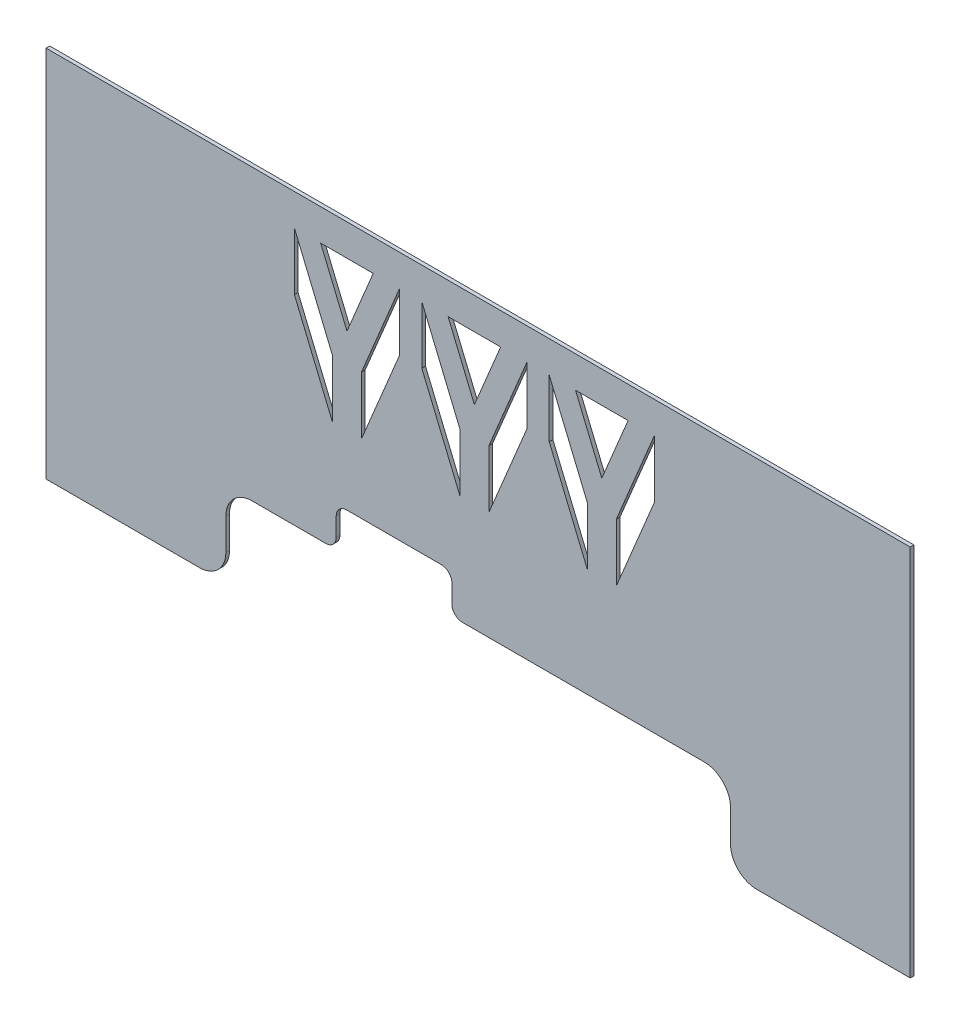
from build123d import *

# Parameters (mm, degrees)
BOSS_EXTRUDE1_DEPTH = 0.7
BOSS_EXTRUDE2_DEPTH = 5
FILLET1_R           = 5
FILLET2_R           = 2


with BuildPart() as part:
    # Sketch1 → Boss-Extrude1 (new body)
    with BuildSketch(Plane.XY):
        Polygon((0, 71), (0, 0), (34.19199, 0), (34.19199, 16), (55.19199, 16), (55.19199, 23.5), (77.19199, 23.5), (77.19199, 16), (130.19199, 16), (130.19199, 0), (164.38398, 0), (164.38398, 71), align=None)
        Polygon((47.233378, 65), (54.483378, 47.6), (54.483378, 36.6), (47.233378, 54), align=None, mode=Mode.SUBTRACT)
        Polygon((67.233378, 65), (67.233378, 54), (59.983378, 36.6), (59.983378, 47.6), align=None, mode=Mode.SUBTRACT)
        Polygon((71.472387, 65), (78.722387, 47.6), (78.722387, 36.6), (71.472387, 54), align=None, mode=Mode.SUBTRACT)
        Polygon((57.233378, 53), (52.233378, 65), (62.233378, 65), align=None, mode=Mode.SUBTRACT)
        Polygon((81.472387, 53), (76.472387, 65), (86.472387, 65), align=None, mode=Mode.SUBTRACT)
        Polygon((91.472387, 65), (91.472387, 54), (84.222387, 36.6), (84.222387, 47.6), align=None, mode=Mode.SUBTRACT)
        Polygon((95.711396, 65), (102.961396, 47.6), (102.961396, 36.6), (95.711396, 54), align=None, mode=Mode.SUBTRACT)
        Polygon((115.711396, 65), (115.711396, 54), (108.461396, 36.6), (108.461396, 47.6), align=None, mode=Mode.SUBTRACT)
        Polygon((105.711396, 53), (100.711396, 65), (110.711396, 65), align=None, mode=Mode.SUBTRACT)
    extrude(amount=BOSS_EXTRUDE1_DEPTH)

    # Sketch1<4> → Boss-Extrude2 (add)
    with BuildSketch(Plane.XY):
        Polygon((10.891348, 64.75), (15.516348, 53.65), (20.141348, 64.75), align=None)
        Polygon((5.766348, 63.75), (5.766348, 54.05), (12.516348, 37.85), (12.516348, 47.55), align=None)
        Polygon((25.266348, 63.75), (18.516348, 47.55), (18.516348, 37.85), (25.266348, 54.05), align=None)
        Polygon((144.673863, 64.75), (149.298863, 53.65), (153.923863, 64.75), align=None)
        Polygon((139.117632, 54.05), (145.867632, 37.85), (145.867632, 47.55), (139.117632, 63.75), align=None)
        Polygon((159.048863, 54.05), (159.048863, 63.75), (152.298863, 47.55), (152.298863, 37.85), align=None)
    extrude(amount=-BOSS_EXTRUDE2_DEPTH)

    # Fillet1
    fillet1_edges = [part.edges().sort_by_distance(p)[0] for p in [
        (130.19199, 16, 0.35),
        (130.19199, 0, 0.35),
        (34.19199, 0, 0.35),
        (34.19199, 16, 0.35),
    ]]
    fillet(fillet1_edges, radius=FILLET1_R)

    # Fillet2
    fillet2_edges = [part.edges().sort_by_distance(p)[0] for p in [
        (77.19199, 16, 0.35),
        (77.19199, 23.5, 0.35),
        (55.19199, 16, 0.35),
        (55.19199, 23.5, 0.35),
    ]]
    fillet(fillet2_edges, radius=FILLET2_R)


solid = part.part
